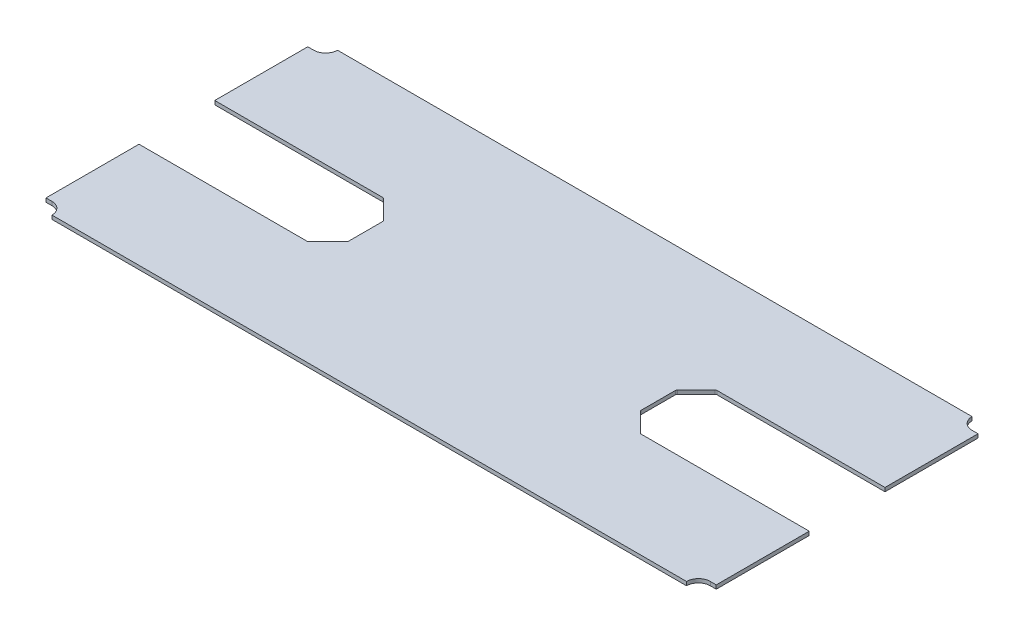
from build123d import *

# Parameters (mm, degrees)
BOSS_EXTRUDE1_DEPTH = 9.525
CHAMFER1_SIZE       = 50
FILLET2_R           = 5


with BuildPart() as part:
    # Sketch1 → Boss-Extrude1 (new body)
    with BuildSketch(Plane(origin=(0, 0, 0), x_dir=(1, 0, 0), z_dir=(0, 1, 0))):
        with BuildLine():
            Line((-845, 330), (-845, 95.5))
            Line((-845, 95.5), (-369, 95.5))
            Line((-369, 95.5), (-369, -95.5))
            Line((-369, -95.5), (-845, -95.5))
            Line((-845, -95.5), (-845, -330))
            Line((-845, -330), (-830, -330))
            ThreePointArc((-830, -330), (-808.786796564, -338.786796564), (-800, -360))
            Line((-800, -360), (800, -360))
            ThreePointArc((800, -360), (808.786796564, -338.786796564), (830, -330))
            Line((830, -330), (845, -330))
            Line((845, -330), (845, -95.5))
            Line((845, -95.5), (369, -95.5))
            Line((369, -95.5), (369, 95.5))
            Line((369, 95.5), (845, 95.5))
            Line((845, 95.5), (845, 330))
            Line((845, 330), (830, 330))
            ThreePointArc((830, 330), (808.786796564, 338.786796564), (800, 360))
            Line((800, 360), (-800, 360))
            ThreePointArc((-800, 360), (-808.786796564, 338.786796564), (-830, 330))
            Line((-830, 330), (-845, 330))
        make_face()
    extrude(amount=BOSS_EXTRUDE1_DEPTH)

    # Chamfer1
    chamfer1_edges = [part.edges().sort_by_distance(p)[0] for p in [
        (369, 4.7625, 95.5),
        (369, 4.7625, -95.5),
        (-369, 4.7625, 95.5),
        (-369, 4.7625, -95.5),
    ]]
    chamfer(chamfer1_edges, length=CHAMFER1_SIZE)

    # Fillet2
    fillet2_edges = [part.edges().sort_by_distance(p)[0] for p in [
        (369, 4.7625, -45.5),
        (369, 4.7625, 45.5),
        (419, 4.7625, 95.5),
        (419, 4.7625, -95.5),
        (-419, 4.7625, 95.5),
        (-369, 4.7625, 45.5),
        (-369, 4.7625, -45.5),
        (-419, 4.7625, -95.5),
    ]]
    fillet(fillet2_edges, radius=FILLET2_R)


solid = part.part
